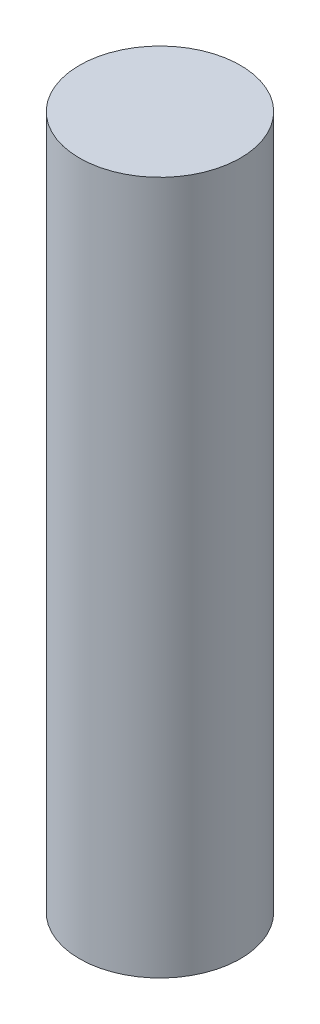
from build123d import *

# Parameters (mm, degrees)
SKETCH1_R           = 5.8
BOSS_EXTRUDE1_DEPTH = 50


with BuildPart() as part:
    # Sketch1 → Boss-Extrude1 (new body)
    with BuildSketch(Plane(origin=(0, 0, 0), x_dir=(1, 0, 0), z_dir=(0, 1, 0))):
        Circle(SKETCH1_R)
    extrude(amount=BOSS_EXTRUDE1_DEPTH)


solid = part.part
